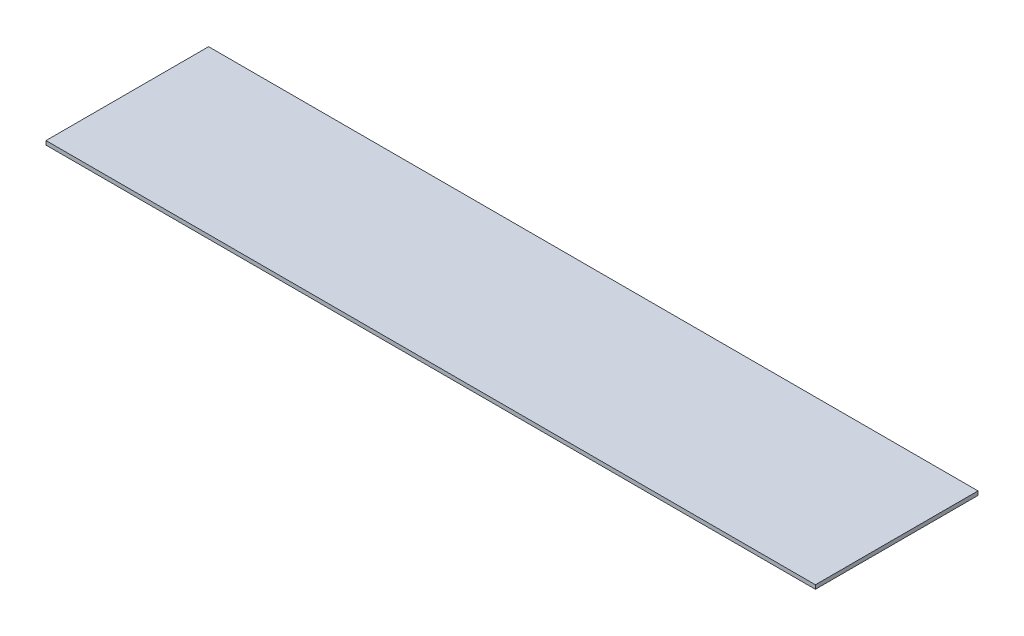
from build123d import *

# Parameters (mm, degrees)
SKETCH1_W           = 615.95
SKETCH1_H           = 130.175
BOSS_EXTRUDE1_DEPTH = 3.175


with BuildPart() as part:
    # Sketch1 → Boss-Extrude1 (new body)
    with BuildSketch(Plane(origin=(0, 0, 0), x_dir=(1, 0, 0), z_dir=(0, 1, 0))):
        Rectangle(SKETCH1_W, SKETCH1_H)
    extrude(amount=BOSS_EXTRUDE1_DEPTH)


solid = part.part
